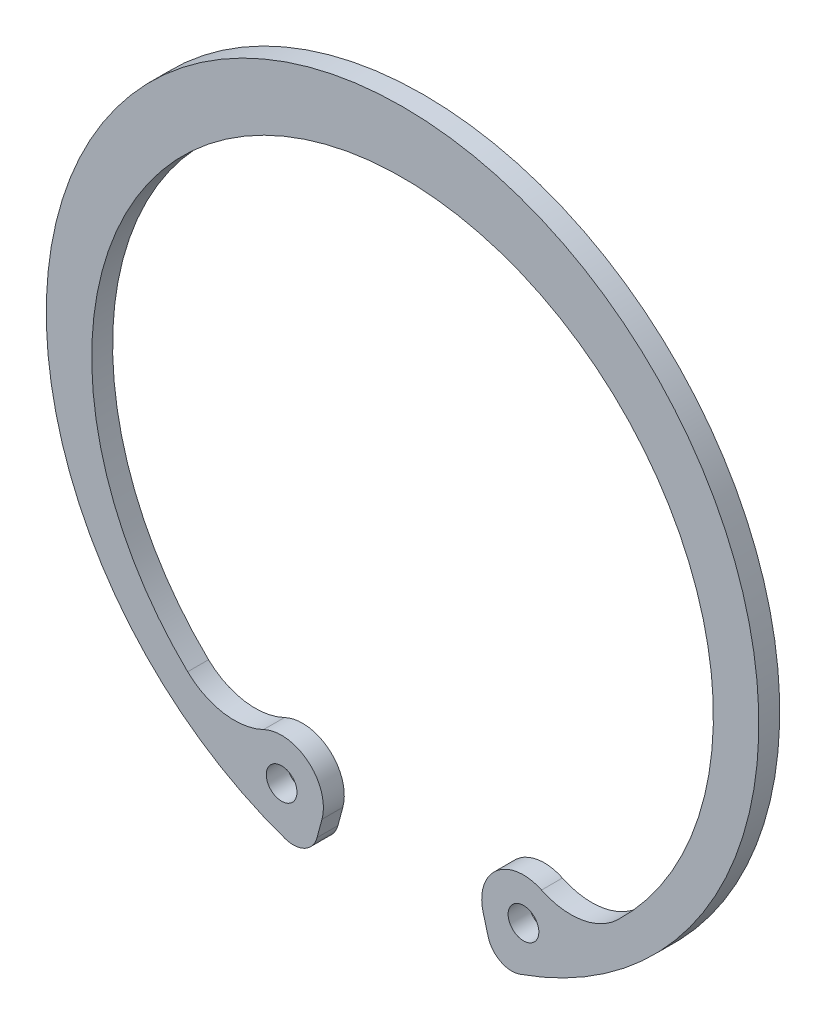
from build123d import *

# Parameters (mm, degrees)
SKETCH_3_R      = 1.25
EXTRUDE_1_DEPTH = 1.7


with BuildPart() as part:
    # Эскиз3 → Бобышка-Вытянуть1 (new body)
    with BuildSketch(Plane.XY):
        with BuildLine():
            Line((-6.962906653, -26.01330129), (-6.559977391, -24.517636691))
            ThreePointArc((-6.559977391, -24.517636691), (-7.669340467, -21.018736494), (-11.311989723, -20.566967284))
            ThreePointArc((-11.311989723, -20.566967284), (-14.555224914, -21.038124912), (-17.490687063, -19.580858295))
            ThreePointArc((-17.490687063, -19.580858295), (0, 24), (17.490687063, -19.580858295))
            ThreePointArc((17.490687063, -19.580858295), (14.555224914, -21.038124912), (11.311989723, -20.566967284))
            ThreePointArc((11.311989723, -20.566967284), (7.669340467, -21.018736494), (6.559977391, -24.517636691))
            Line((6.559977391, -24.517636691), (6.962906653, -26.01330129))
            ThreePointArc((6.962906653, -26.01330129), (7.959900212, -27.261484788), (9.552876045, -27.381427269))
            ThreePointArc((9.552876045, -27.381427269), (0, 29), (-9.552876045, -27.381427269))
            ThreePointArc((-9.552876045, -27.381427269), (-7.959900212, -27.261484788), (-6.962906653, -26.01330129))
        make_face()
        with Locations((-9.842932993, -23.633214555)):
            Circle(SKETCH_3_R, mode=Mode.SUBTRACT)
        with Locations((9.842932993, -23.633214555)):
            Circle(SKETCH_3_R, mode=Mode.SUBTRACT)
    extrude(amount=EXTRUDE_1_DEPTH)


solid = part.part
